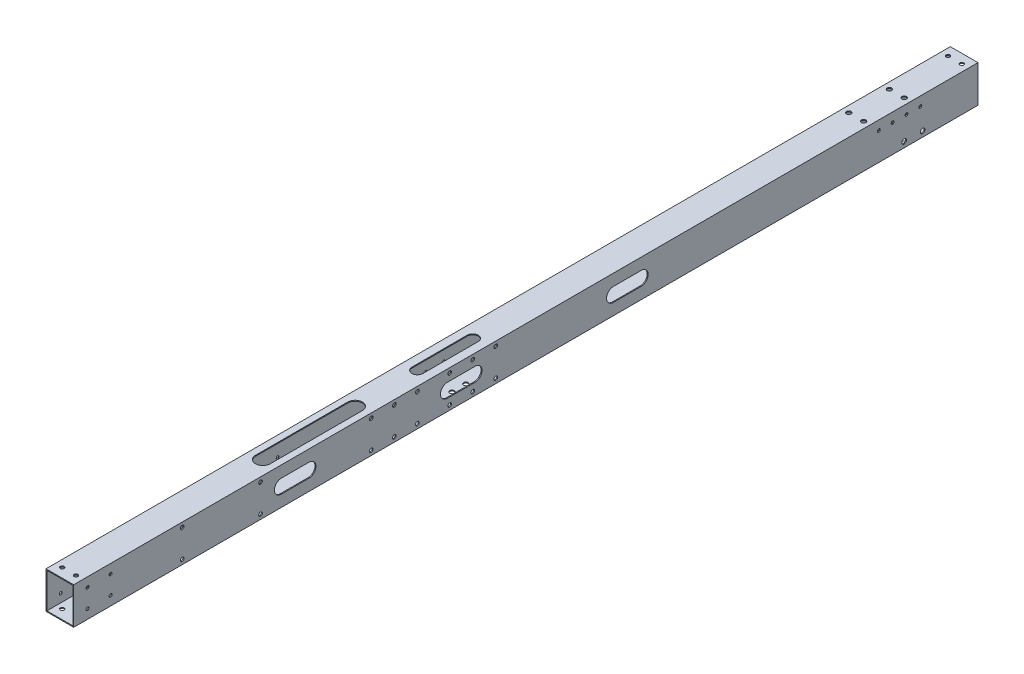
from build123d import *

# Parameters (mm, degrees)
SKETCH_1_W             = 30
SKETCH_1_H             = 40
SKETCH_1_W_2           = 28
SKETCH_1_H_2           = 38
EXTRUDE_1_DEPTH        = 940
SKETCH_5_R             = 2.5
CUT_EXTRUDE_3_DEPTH    = 941.97024395
CUT_EXTRUDE_4_DEPTH    = 1
SKETCH_7_R             = 1.5
CUT_EXTRUDE_5_DEPTH    = 1
SKETCH_17_W            = 30
SKETCH_17_H            = 40
SKETCH_17_W_2          = 28
SKETCH_17_H_2          = 38
EXTRUDE_2_DEPTH        = 20
SKETCH_18_W            = 30
SKETCH_18_H            = 40
SKETCH_18_W_2          = 28
SKETCH_18_H_2          = 38
EXTRUDE_3_DEPTH        = 20
SKETCH_19_R            = 2.1
CUT_EXTRUDE_16_DEPTH   = 961.950050731
SKETCH_20_R            = 1.6
CUT_EXTRUDE_17_DEPTH   = 961.67684473
SKETCH_21_R            = 2.5
SKETCH_21_R_2          = 1.6
CUT_EXTRUDE_18_DEPTH   = 961.67684473
SKETCH_23_R            = 2.5
CUT_EXTRUDE_19_DEPTH   = 961.950050731
SKETCH_24_R            = 4.5
CUT_EXTRUDE_20_DEPTH   = 10
SKETCH_26_R            = 2
CUT_EXTRUDE_22_DEPTH   = 961.67684473
CUT_EXTRUDE_28_DEPTH   = 10
PATTERN_LINEAR_4_COUNT = 2
PATTERN_LINEAR_4_PITCH = 255
PATTERN_LINEAR_8_COUNT = 2
PATTERN_LINEAR_8_PITCH = 205
PATTERN_LINEAR_9_COUNT = 2
PATTERN_LINEAR_9_PITCH = 230
CUT_EXTRUDE_START      = -20
SKETCH_34_R            = 1.75
CUT_EXTRUDE_29_DEPTH   = 20
SKETCH_35_R            = 1.5
CUT_EXTRUDE_30_DEPTH   = 10
CUT_EXTRUDE_31_DEPTH   = 10


with BuildPart() as part:
    # 草图1 → 凸台-拉伸1 (new body)
    with BuildSketch(Plane.XY):
        Rectangle(SKETCH_1_W, SKETCH_1_H)
        Rectangle(SKETCH_1_W_2, SKETCH_1_H_2, mode=Mode.SUBTRACT)
    extrude(amount=EXTRUDE_1_DEPTH)

    # 草图5 → 切除-拉伸3 (cut, through all)
    with BuildSketch(Plane.XZ.offset(20)):
        with Locations((-8, 53)):
            Circle(SKETCH_5_R)
        with Locations((8, 53)):
            Circle(SKETCH_5_R)
        with Locations((-8, 97)):
            Circle(SKETCH_5_R)
        with Locations((8, 97)):
            Circle(SKETCH_5_R)
    extrude(amount=-CUT_EXTRUDE_3_DEPTH, mode=Mode.SUBTRACT)

    # 草图6 → 切除-拉伸4 (cut)
    with BuildSketch(Plane(origin=(15, 0, 0), x_dir=(0, 0, -1), z_dir=(1, 0, 0))):
        with BuildLine():
            Line((-345, -7.5), (-375, -7.5))
            ThreePointArc((-375, -7.5), (-382.5, 0), (-375, 7.5))
            Line((-375, 7.5), (-345, 7.5))
            ThreePointArc((-345, 7.5), (-337.5, 0), (-345, -7.5))
        make_face()
        with BuildLine():
            Line((-525, -7.5), (-555, -7.5))
            ThreePointArc((-555, -7.5), (-562.5, 0), (-555, 7.5))
            Line((-555, 7.5), (-525, 7.5))
            ThreePointArc((-525, 7.5), (-517.5, 0), (-525, -7.5))
        make_face()
        with BuildLine():
            Line((-705, -7.5), (-735, -7.5))
            ThreePointArc((-735, -7.5), (-742.5, 0), (-735, 7.5))
            Line((-735, 7.5), (-705, 7.5))
            ThreePointArc((-705, 7.5), (-697.5, 0), (-705, -7.5))
        make_face()
    extrude(amount=-CUT_EXTRUDE_4_DEPTH, mode=Mode.SUBTRACT)

    # 草图7 → 切除-拉伸5 (cut)
    with BuildSketch(Plane.ZY.offset(15)):
        with Locations((350, 0)):
            Circle(SKETCH_7_R)
        with Locations((370, 0)):
            Circle(SKETCH_7_R)
        with Locations((530, 0)):
            Circle(SKETCH_7_R)
        with Locations((550, 0)):
            Circle(SKETCH_7_R)
        with Locations((710, 0)):
            Circle(SKETCH_7_R)
        with Locations((730, 0)):
            Circle(SKETCH_7_R)
    extrude(amount=-CUT_EXTRUDE_5_DEPTH, mode=Mode.SUBTRACT)

    # 草图17 → 凸台-拉伸2 (add)
    with BuildSketch(Plane.XY.offset(940)):
        Rectangle(SKETCH_17_W, SKETCH_17_H)
        Rectangle(SKETCH_17_W_2, SKETCH_17_H_2, mode=Mode.SUBTRACT)
    extrude(amount=EXTRUDE_2_DEPTH)

    # 草图18 → 凸台-拉伸3 (add)
    with BuildSketch(Plane(origin=(0, 0, 0), x_dir=(-1, 0, 0), z_dir=(0, 0, -1))):
        Rectangle(SKETCH_18_W, SKETCH_18_H)
        Rectangle(SKETCH_18_W_2, SKETCH_18_H_2, mode=Mode.SUBTRACT)
    extrude(amount=EXTRUDE_3_DEPTH)

    # 草图19 → 切除-拉伸16 (cut, through all)
    with BuildSketch(Plane(origin=(0, 20, 0), x_dir=(1, 0, 0), z_dir=(0, 1, 0))):
        with Locations((-7.5, -950)):
            Circle(SKETCH_19_R)
        with Locations((7.5, -950)):
            Circle(SKETCH_19_R)
        with Locations((-7.5, 10)):
            Circle(SKETCH_19_R)
        with Locations((7.5, 10)):
            Circle(SKETCH_19_R)
    extrude(amount=-CUT_EXTRUDE_16_DEPTH, mode=Mode.SUBTRACT)

    # 草图20 → 切除-拉伸17 (cut, through all)
    with BuildSketch(Plane(origin=(15, 0, 0), x_dir=(0, 0, -1), z_dir=(1, 0, 0))):
        with Locations((-945, 10)):
            Circle(SKETCH_20_R)
        with Locations((-920, 10)):
            Circle(SKETCH_20_R)
        with Locations((-920, -10)):
            Circle(SKETCH_20_R)
        with Locations((-945, -10)):
            Circle(SKETCH_20_R)
    extrude(amount=-CUT_EXTRUDE_17_DEPTH, mode=Mode.SUBTRACT)

    # 草图21 → 切除-拉伸18 (cut, through all)
    with BuildSketch(Plane(origin=(15, 0, 0), x_dir=(0, 0, -1), z_dir=(1, 0, 0))):
        with Locations((-40, -14)):
            Circle(SKETCH_21_R)
        with Locations((-60, -14)):
            Circle(SKETCH_21_R)
        with Locations((-42.5, 10)):
            Circle(SKETCH_21_R_2)
        with Locations((-57.5, 10)):
            Circle(SKETCH_21_R_2)
        with Locations((-72.5, 10)):
            Circle(SKETCH_21_R_2)
        with Locations((-87.5, 10)):
            Circle(SKETCH_21_R_2)
    extrude(amount=-CUT_EXTRUDE_18_DEPTH, mode=Mode.SUBTRACT)

    # 草图23 → 切除-拉伸19 (cut, through all)
    with BuildSketch(Plane(origin=(0, 20, 0), x_dir=(1, 0, 0), z_dir=(0, 1, 0))):
        with Locations((0, -520)):
            Circle(SKETCH_23_R)
        with Locations((0, -535)):
            Circle(SKETCH_23_R)
        with Locations((0, -550)):
            Circle(SKETCH_23_R)
        with Locations((0, -565)):
            Circle(SKETCH_23_R)
    extrude(amount=-CUT_EXTRUDE_19_DEPTH, mode=Mode.SUBTRACT)

    # 草图24 → 切除-拉伸20 (cut)
    with BuildSketch(Plane(origin=(0, 20, 0), x_dir=(1, 0, 0), z_dir=(0, 1, 0))):
        with Locations((0, -520)):
            Circle(SKETCH_24_R)
        with Locations((0, -535)):
            Circle(SKETCH_24_R)
        with Locations((0, -550)):
            Circle(SKETCH_24_R)
        with Locations((0, -565)):
            Circle(SKETCH_24_R)
    extrude(amount=-CUT_EXTRUDE_20_DEPTH, mode=Mode.SUBTRACT)

    # 草图26 → 切除-拉伸22 (cut, through all)
    with BuildSketch(Plane(origin=(15, 0, 0), x_dir=(0, 0, -1), z_dir=(1, 0, 0))):
        with Locations((-842.5, 15)):
            Circle(SKETCH_26_R)
        with Locations((-842.5, -15)):
            Circle(SKETCH_26_R)
        with Locations((-757.5, -15)):
            Circle(SKETCH_26_R)
        with Locations((-757.5, 15)):
            Circle(SKETCH_26_R)
    cut_extrude_22 = extrude(amount=-CUT_EXTRUDE_22_DEPTH, mode=Mode.SUBTRACT)

    # 草图33 → 切除-拉伸28 (cut)
    with BuildSketch(Plane(origin=(0, 20, 0), x_dir=(1, 0, 0), z_dir=(0, 1, 0))):
        with BuildLine():
            Line((6, -512.5), (6, -572.5))
            ThreePointArc((6, -572.5), (0, -578.5), (-6, -572.5))
            Line((-6, -572.5), (-6, -512.5))
            ThreePointArc((-6, -512.5), (0, -506.5), (6, -512.5))
        make_face()
    extrude(amount=-CUT_EXTRUDE_28_DEPTH, mode=Mode.SUBTRACT)

    # 阵列(线性)4: 切除-拉伸22 ×2
    with Locations(*[(0, 0, -i * PATTERN_LINEAR_4_PITCH) for i in range(1, PATTERN_LINEAR_4_COUNT)]):
        add(cut_extrude_22, mode=Mode.SUBTRACT)

    # 阵列(线性)8: 切除-拉伸22 ×2
    with Locations(*[(0, 0, -i * PATTERN_LINEAR_8_PITCH) for i in range(1, PATTERN_LINEAR_8_COUNT)]):
        add(cut_extrude_22, mode=Mode.SUBTRACT)

    # 阵列(线性)9: 切除-拉伸22 ×2
    with Locations(*[(0, 0, -i * PATTERN_LINEAR_9_PITCH) for i in range(1, PATTERN_LINEAR_9_COUNT)]):
        add(cut_extrude_22, mode=Mode.SUBTRACT)

    # 草图34 → 切除-拉伸29 (cut)
    with BuildSketch(Plane(origin=(15, 0, 0), x_dir=(0, 0, -1), z_dir=(1, 0, 0)).offset(CUT_EXTRUDE_START)):
        with Locations((-935, 0)):
            Circle(SKETCH_34_R)
        with Locations((-915, 0)):
            Circle(SKETCH_34_R)
    extrude(amount=-CUT_EXTRUDE_29_DEPTH, mode=Mode.SUBTRACT)

    # 草图35 → 切除-拉伸30 (cut)
    with BuildSketch(Plane.XZ.offset(20)):
        with Locations((5, 720)):
            Circle(SKETCH_35_R)
        with Locations((5, 700)):
            Circle(SKETCH_35_R)
        with Locations((5, 680)):
            Circle(SKETCH_35_R)
        with Locations((5, 660)):
            Circle(SKETCH_35_R)
        with Locations((5, 640)):
            Circle(SKETCH_35_R)
        with Locations((5, 740)):
            Circle(SKETCH_35_R)
    extrude(amount=-CUT_EXTRUDE_30_DEPTH, mode=Mode.SUBTRACT)

    # 草图36 → 切除-拉伸31 (cut)
    with BuildSketch(Plane(origin=(0, 20, 0), x_dir=(1, 0, 0), z_dir=(0, 1, 0))):
        with BuildLine():
            Line((8, -640), (8, -740))
            ThreePointArc((8, -740), (0, -748), (-8, -740))
            Line((-8, -740), (-8, -640))
            ThreePointArc((-8, -640), (0, -632), (8, -640))
        make_face()
    extrude(amount=-CUT_EXTRUDE_31_DEPTH, mode=Mode.SUBTRACT)


solid = part.part
